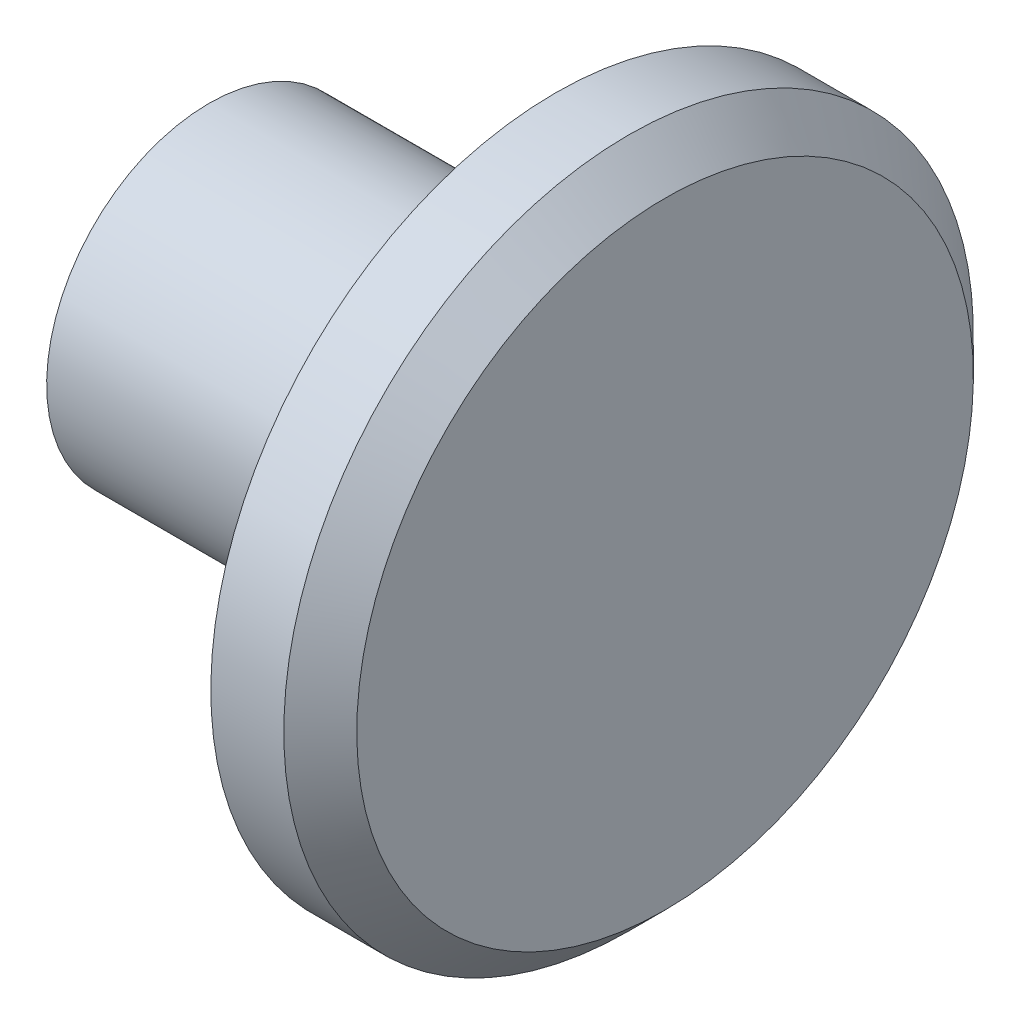
from build123d import *

# Parameters (mm, degrees)
CHAMFER1_SIZE = 1


with BuildPart() as part:
    # Sketch1 → Revolve1 (revolve)
    with BuildSketch(Plane.XY):
        Polygon((-6.25, -4.45), (3.25, -4.45), (3.25, -9.45), (6.25, -9.45), (6.25, 0), (-6.25, 0), align=None)
    revolve(axis=Axis((6.25, 0, 0), (-1, 0, 0)))

    # Chamfer1
    chamfer1_edges = [part.edges().sort_by_distance(p)[0] for p in [
        (6.25, 9.45, 0),
    ]]
    chamfer(chamfer1_edges, length=CHAMFER1_SIZE)


solid = part.part
